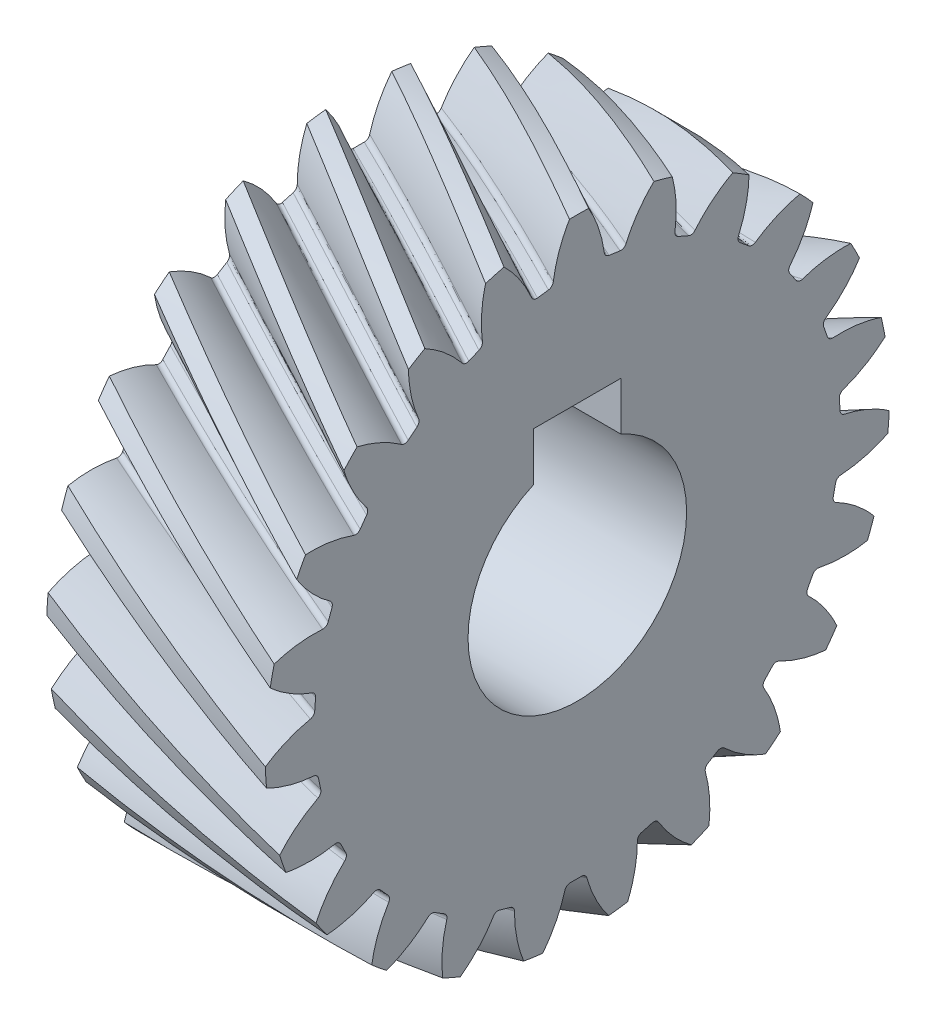
from build123d import *

# Parameters (mm, degrees)
BASPROSKE_W            = 10
BASPROSKE_H            = 14.279056191
TOOTHCUTRH_PITCH       = 155.396058251
TOOTHCUTRH_HEIGHT      = 10
TOOTHCUTRH_RADIUS      = 14.279056191
TOOTHCUTRH_START_ANGLE = -90
TEETHCUTSRH_COUNT      = 23
TEETHCUTSRH_ANGLE      = 344.347826087
BORSKE_R               = 5
BORE_DEPTH             = 62.5000025
KEYSKE_W               = 4
KEYSKE_H               = 6.8
KEYWAY_DEPTH           = 62.5000025


with BuildPart() as part:
    # BasProSke → Base-Revolve (revolve)
    with BuildSketch(Plane(origin=(0, 0, 0), x_dir=(1, 0, 0), z_dir=(0, 1, 0)), mode=Mode.PRIVATE) as base_revolve_sk:
        with Locations((5, 7.139528096)):
            Rectangle(BASPROSKE_W, BASPROSKE_H)
    revolve(base_revolve_sk.sketch.rotate(Axis((-10, 0, 0), (1, 0, 0)), 180), axis=Axis((-10, 0, 0), (1, 0, 0)))

    # ToothCutRH: sweep along a helix
    with BuildLine() as toothcutrh_path:
        add(Helix(TOOTHCUTRH_PITCH, TOOTHCUTRH_HEIGHT, TOOTHCUTRH_RADIUS, center=(0, 0, 0), direction=(1, 0, 0), mode=Mode.PRIVATE).rotate(Axis((0, 0, 0), (1, 0, 0)), TOOTHCUTRH_START_ANGLE))
    # TooCutSkeRH → ToothCutRH (sweep, cut)
    with BuildSketch(Plane(origin=(0, 0, 0), x_dir=(0, 0, -1), z_dir=(1, 0, 0))):
        with BuildLine():
            ThreePointArc((0.253741339, 12.026379679), (0, 12.029056191), (-0.253741339, 12.026379679))
            ThreePointArc((-0.253741339, 12.026379679), (-0.408448862, 12.075638979), (-0.500638989, 12.209287313))
            ThreePointArc((-0.500638989, 12.209287313), (-1.030412191, 13.481387725), (-1.847638253, 14.590910446))
            ThreePointArc((-1.847638253, 14.590910446), (0, 14.707427877), (1.847638253, 14.590910446))
            ThreePointArc((1.847638253, 14.590910446), (1.030412191, 13.481387725), (0.500638989, 12.209287313))
            ThreePointArc((0.500638989, 12.209287313), (0.408448862, 12.075638979), (0.253741339, 12.026379679))
        make_face()
    toothcutrh = sweep(path=toothcutrh_path.line, is_frenet=True, mode=Mode.SUBTRACT)

    # TeethCutsRH: ToothCutRH ×23 about axis
    teethcutsrh_axis = Axis((-10, 0, 0), (1, 0, 0))
    for i in range(1, TEETHCUTSRH_COUNT):
        add(toothcutrh.rotate(teethcutsrh_axis, i * TEETHCUTSRH_ANGLE / (TEETHCUTSRH_COUNT - 1)), mode=Mode.SUBTRACT)

    # BorSke → Bore (cut, symmetric)
    with BuildSketch(Plane(origin=(0, 0, 0), x_dir=(0, 0, -1), z_dir=(1, 0, 0))):
        with Locations(Location((0, 0, 0), (0, 0, 180))):
            Circle(BORSKE_R)
    extrude(amount=BORE_DEPTH, both=True, mode=Mode.SUBTRACT)

    # KeySke → Keyway (cut, symmetric)
    with BuildSketch(Plane(origin=(0, 0, 0), x_dir=(0, 0, -1), z_dir=(1, 0, 0))):
        with Locations((0, 3.4)):
            Rectangle(KEYSKE_W, KEYSKE_H)
    extrude(amount=KEYWAY_DEPTH, both=True, mode=Mode.SUBTRACT)


solid = part.part
